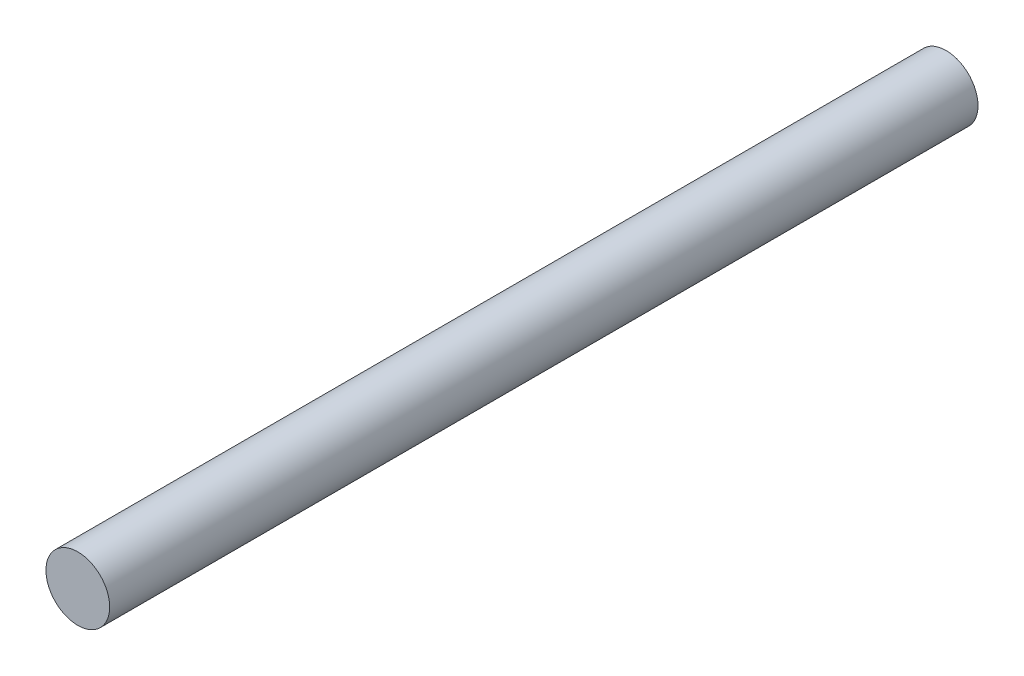
from build123d import *

# Parameters (mm, degrees)
CROQUIS1_R              = 4
SALIENTE_EXTRUIR1_DEPTH = 54.5


with BuildPart() as part:
    # Croquis1 → Saliente-Extruir1 (new, symmetric)
    with BuildSketch(Plane.XY):
        Circle(CROQUIS1_R)
    extrude(amount=SALIENTE_EXTRUIR1_DEPTH, both=True)


solid = part.part
